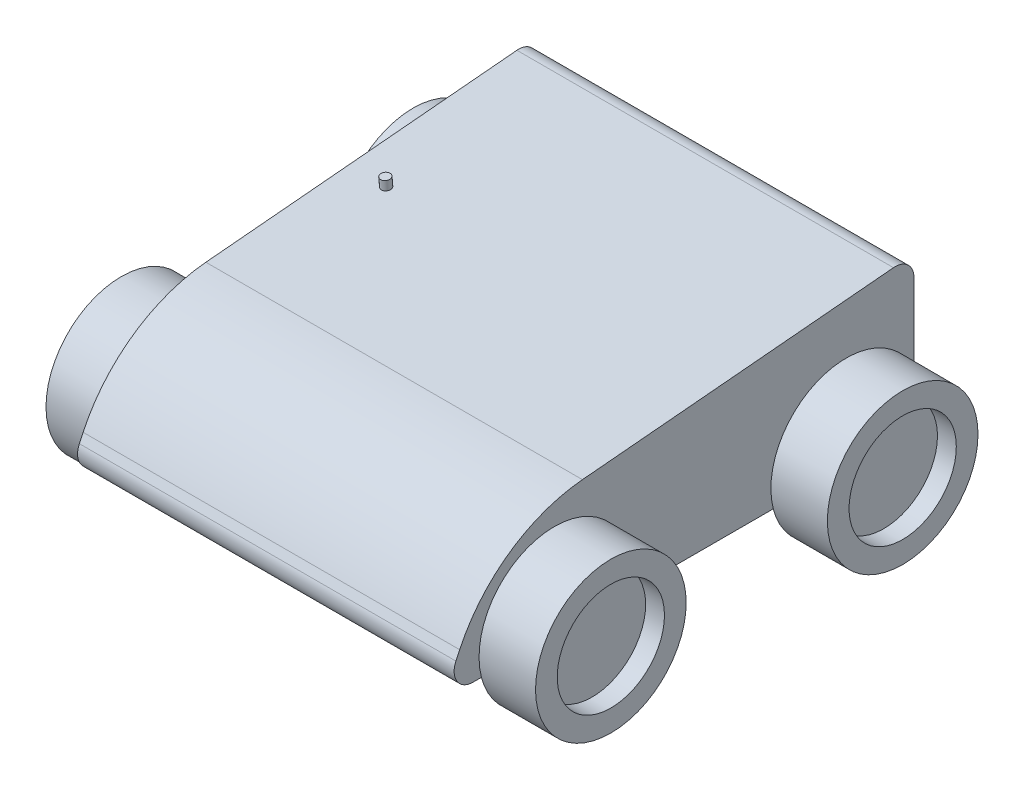
from build123d import *

# Parameters (mm, degrees)
BOSS_EXTRUDE1_DEPTH     = 100
SKETCH3_R               = 25
CUT_EXTRUDE1_DEPTH      = 50
SKETCH4_R               = 2.5
BOSS_EXTRUDE2_DEPTH     = 5
SKETCH5_R               = 40
BOSS_EXTRUDE3_DEPTH     = 30
SKETCH6_R               = 28.477032585
CUT_EXTRUDE2_DEPTH      = 10
LPATTERN1_COUNT         = 2
LPATTERN1_PITCH         = 155
MIRROR2_COPY_1_SKETCH_R = 40
MIRROR2_COPY_1_DEPTH    = 30
MIRROR2_COPY_2_SKETCH_R = 28.477032585
MIRROR2_COPY_2_DEPTH    = 10
MIRROR2_COPY_3_SKETCH_R = 40
MIRROR2_COPY_3_DEPTH    = 30
MIRROR2_COPY_4_SKETCH_R = 28.477032585
MIRROR2_COPY_4_DEPTH    = 10


with BuildPart() as part:
    # Sketch2 → Boss-Extrude1 (new, symmetric)
    with BuildSketch(Plane(origin=(0, 0, 0), x_dir=(0, 0, -1), z_dir=(1, 0, 0))):
        with BuildLine():
            Line((-112.643906845, 14.257821235), (-110.645286598, 18.505070953))
            ThreePointArc((-110.645286598, 18.505070953), (-84.118524888, 49.993435328), (-45.444881226, 64.119137564))
            Line((-45.444881226, 64.119137564), (119.748610721, 79.017143226))
            ThreePointArc((119.748610721, 79.017143226), (127.392850703, 76.439367824), (130.646817248, 69.057563665))
            Line((130.646817248, 69.057563665), (130.646817248, 10))
            ThreePointArc((130.646817248, 10), (127.71788506, 2.928932188), (120.646817248, 0))
            Line((120.646817248, 0), (-103.595649647, 0))
            ThreePointArc((-103.595649647, 0), (-112.038937287, 4.641745263), (-112.643906845, 14.257821235))
        make_face()
    extrude(amount=BOSS_EXTRUDE1_DEPTH, both=True)

    # Sketch3 → Cut-Extrude1 (cut)
    with BuildSketch(Plane(origin=(100, 0, 0), x_dir=(0, 0, -1), z_dir=(1, 0, 0))):
        with Locations((-60.35749377, 10)):
            Circle(SKETCH3_R)
        with Locations((95.561704497, 10)):
            Circle(SKETCH3_R)
    cut_extrude1 = extrude(amount=-CUT_EXTRUDE1_DEPTH, mode=Mode.SUBTRACT)

    # Mirror1: Cut-Extrude1 across plane
    add(cut_extrude1.mirror(Plane(origin=(0, 0, 0), x_dir=(0, 0, 1), z_dir=(1, 0, 0))), mode=Mode.SUBTRACT)

    # Sketch4 → Boss-Extrude2 (add)
    with BuildSketch(Plane(origin=(0, 67.667230134, 6.102581681), x_dir=(1, 0, 0), z_dir=(0, 0.9959579561140941, 0.0898206527088083))):
        with Locations((-80, 36.574402855)):
            Circle(SKETCH4_R)
    extrude(amount=BOSS_EXTRUDE2_DEPTH)

    # Sketch5 → Boss-Extrude3 (add)
    with BuildSketch(Plane(origin=(100, 0, 0), x_dir=(0, 0, -1), z_dir=(1, 0, 0))):
        with Locations((-60.35749377, 10)):
            Circle(SKETCH5_R)
    boss_extrude3 = extrude(amount=BOSS_EXTRUDE3_DEPTH)

    # Sketch6 → Cut-Extrude2 (cut)
    with BuildSketch(Plane(origin=(130, 0, 0), x_dir=(0, 0, -1), z_dir=(1, 0, 0))):
        with Locations((-60.35749377, 10)):
            Circle(SKETCH6_R)
    cut_extrude2 = extrude(amount=-CUT_EXTRUDE2_DEPTH, mode=Mode.SUBTRACT)

    # LPattern1: Boss-Extrude3, Cut-Extrude2 ×2
    with Locations(*[(0, 0, -i * LPATTERN1_PITCH) for i in range(1, LPATTERN1_COUNT)]):
        add(boss_extrude3)
        add(cut_extrude2, mode=Mode.SUBTRACT)

    # Mirror2 copy 1 sketch → Mirror2 copy 1 (add)
    with BuildSketch(Plane(origin=(-100, 0, -155), x_dir=(0, 0, -1), z_dir=(-1, 0, 0))):
        with Locations((-60.35749377, -10)):
            Circle(MIRROR2_COPY_1_SKETCH_R)
    extrude(amount=MIRROR2_COPY_1_DEPTH)

    # Mirror2 copy 2 sketch → Mirror2 copy 2 (cut)
    with BuildSketch(Plane(origin=(-130, 0, -155), x_dir=(0, 0, -1), z_dir=(-1, 0, 0))):
        with Locations((-60.35749377, -10)):
            Circle(MIRROR2_COPY_2_SKETCH_R)
    extrude(amount=-MIRROR2_COPY_2_DEPTH, mode=Mode.SUBTRACT)

    # Mirror2 copy 3 sketch → Mirror2 copy 3 (add)
    with BuildSketch(Plane(origin=(-100, 0, 0), x_dir=(0, 0, -1), z_dir=(-1, 0, 0))):
        with Locations((-60.35749377, -10)):
            Circle(MIRROR2_COPY_3_SKETCH_R)
    extrude(amount=MIRROR2_COPY_3_DEPTH)

    # Mirror2 copy 4 sketch → Mirror2 copy 4 (cut)
    with BuildSketch(Plane(origin=(-130, 0, 0), x_dir=(0, 0, -1), z_dir=(-1, 0, 0))):
        with Locations((-60.35749377, -10)):
            Circle(MIRROR2_COPY_4_SKETCH_R)
    extrude(amount=-MIRROR2_COPY_4_DEPTH, mode=Mode.SUBTRACT)


solid = part.part
